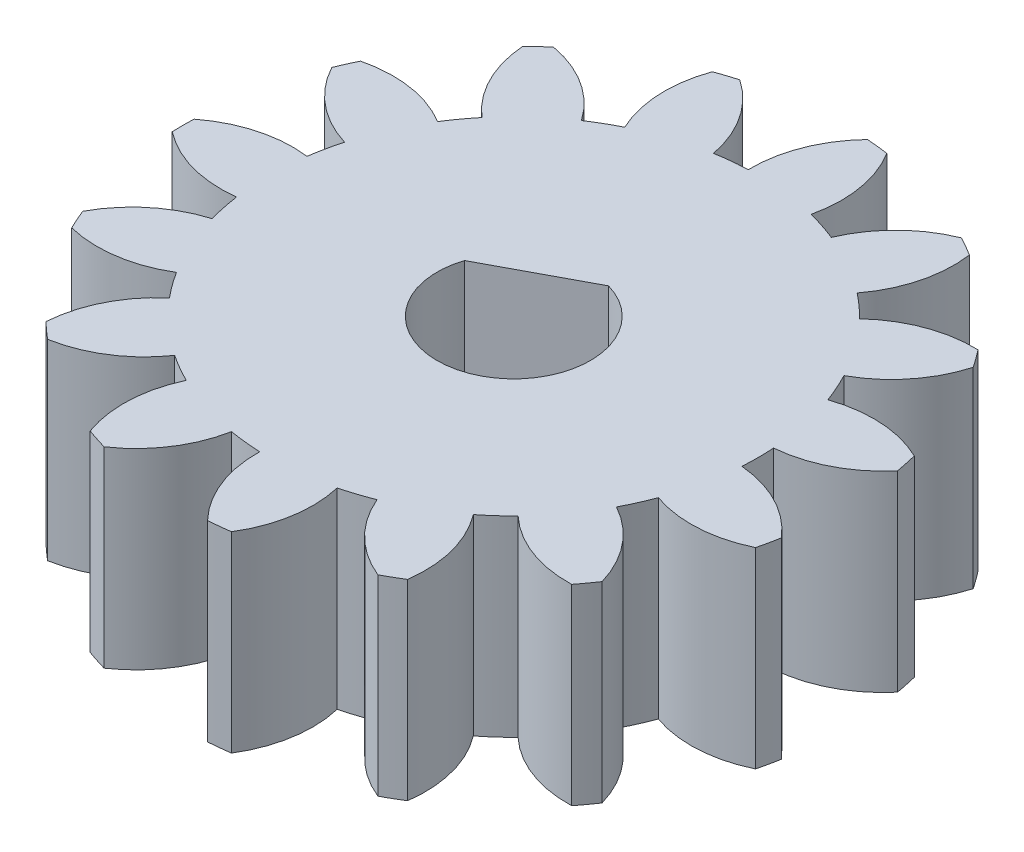
from build123d import *

# Parameters (mm, degrees)
SKETCH1_R           = 56.531668112
BOSS_EXTRUDE1_DEPTH = 5
SKETCH2_R           = 93.360470672
CUT_EXTRUDE1_DEPTH  = 83.481553238
CUT_EXTRUDE2_DEPTH  = 14.170680132


with BuildPart() as part:
    # Sketch1 → Boss-Extrude1 (new body)
    with BuildSketch(Plane(origin=(0, 0, 0), x_dir=(1, 0, 0), z_dir=(0, 1, 0))):
        Circle(SKETCH1_R)
    extrude(amount=BOSS_EXTRUDE1_DEPTH)

    # Sketch2 → Cut-Extrude1 (cut, through all)
    with BuildSketch(Plane(origin=(0.053951493, 9.696123263, -2.690451675), x_dir=(0, 0, 1), z_dir=(0, 1, 0))):
        with Locations((2.690451675, -0.053951493)):
            Circle(SKETCH2_R)
        with BuildLine():
            ThreePointArc((7.987976033, 6.754966533), (7.789005891, 5.548363877), (7.142485611, 4.510341424))
            ThreePointArc((7.142485611, 4.510341424), (7.428743082, 4.212425253), (7.695105184, 3.89659521))
            ThreePointArc((7.695105184, 3.89659521), (8.795021012, 4.431070894), (10.015811815, 4.502826734))
            ThreePointArc((10.015811815, 4.502826734), (10.161652833, 4.259548507), (10.299417449, 4.011607367))
            ThreePointArc((10.299417449, 4.011607367), (9.626879667, 2.990249439), (8.614052233, 2.304932231))
            ThreePointArc((8.614052233, 2.304932231), (8.754388023, 1.916340863), (8.869262259, 1.519476535))
            ThreePointArc((8.869262259, 1.519476535), (10.091476214, 1.560368296), (11.235909836, 1.129380165))
            ThreePointArc((11.235909836, 1.129380165), (11.270192066, 0.84781556), (11.295199558, 0.56527614))
            ThreePointArc((11.295199558, 0.56527614), (10.265382027, -0.094234996), (9.061374505, -0.308349388))
            ThreePointArc((9.061374505, -0.308349388), (9.03152328, -0.720424975), (8.975046852, -1.12970214))
            ThreePointArc((8.975046852, -1.12970214), (10.108227036, -1.589464859), (10.978420508, -2.448675198))
            ThreePointArc((10.978420508, -2.448675198), (10.895216241, -2.719841104), (10.803142587, -2.98812517))
            ThreePointArc((10.803142587, -2.98812517), (9.594110113, -3.171754047), (8.407106342, -2.8776433))
            ThreePointArc((8.407106342, -2.8776433), (8.212229649, -3.241951493), (7.994167845, -3.592873756))
            ThreePointArc((7.994167845, -3.592873756), (8.84237711, -4.473793803), (9.287866075, -5.612661077))
            ThreePointArc((9.287866075, -5.612661077), (9.101562084, -5.826541234), (8.908327655, -6.034181196))
            ThreePointArc((8.908327655, -6.034181196), (7.729132938, -5.710176712), (6.764376652, -4.958695246))
            ThreePointArc((6.764376652, -4.958695246), (6.438170443, -5.212243849), (6.09622813, -5.444133562))
            ThreePointArc((6.09622813, -5.444133562), (6.512803388, -6.593891859), (6.456558756, -7.81549557))
            ThreePointArc((6.456558756, -7.81549557), (6.199368695, -7.935108156), (5.938385479, -8.046201177))
            ThreePointArc((5.938385479, -8.046201177), (4.992921997, -7.270586652), (4.417228324, -6.191672439))
            ThreePointArc((4.417228324, -6.191672439), (4.016096616, -6.290620595), (3.609398725, -6.363381921))
            ThreePointArc((3.609398725, -6.363381921), (3.52231033, -7.583174812), (2.974057309, -8.67628858))
            ThreePointArc((2.974057309, -8.67628858), (2.690451675, -8.680951493), (2.406846041, -8.67628858))
            ThreePointArc((2.406846041, -8.67628858), (1.85859302, -7.583174812), (1.771504625, -6.363381921))
            ThreePointArc((1.771504625, -6.363381921), (1.364806734, -6.290620595), (0.963675026, -6.191672439))
            ThreePointArc((0.963675026, -6.191672439), (0.387981353, -7.270586652), (-0.557482129, -8.046201177))
            ThreePointArc((-0.557482129, -8.046201177), (-0.818465345, -7.935108156), (-1.075655406, -7.81549557))
            ThreePointArc((-1.075655406, -7.81549557), (-1.131900038, -6.593891859), (-0.71532478, -5.444133562))
            ThreePointArc((-0.71532478, -5.444133562), (-1.057267094, -5.212243849), (-1.383473303, -4.958695246))
            ThreePointArc((-1.383473303, -4.958695246), (-2.348229588, -5.710176712), (-3.527424305, -6.034181196))
            ThreePointArc((-3.527424305, -6.034181196), (-3.720658735, -5.826541234), (-3.906962725, -5.612661077))
            ThreePointArc((-3.906962725, -5.612661077), (-3.46147376, -4.473793803), (-2.613264496, -3.592873756))
            ThreePointArc((-2.613264496, -3.592873756), (-2.8313263, -3.241951493), (-3.026202992, -2.8776433))
            ThreePointArc((-3.026202992, -2.8776433), (-4.213206764, -3.171754047), (-5.422239237, -2.98812517))
            ThreePointArc((-5.422239237, -2.98812517), (-5.514312891, -2.719841104), (-5.597517158, -2.448675198))
            ThreePointArc((-5.597517158, -2.448675198), (-4.727323686, -1.589464859), (-3.594143503, -1.12970214))
            ThreePointArc((-3.594143503, -1.12970214), (-3.65061993, -0.720424975), (-3.680471156, -0.308349388))
            ThreePointArc((-3.680471156, -0.308349388), (-4.884478677, -0.094234996), (-5.914296209, 0.56527614))
            ThreePointArc((-5.914296209, 0.56527614), (-5.889288716, 0.84781556), (-5.855006486, 1.129380165))
            ThreePointArc((-5.855006486, 1.129380165), (-4.710572864, 1.560368296), (-3.48835891, 1.519476535))
            ThreePointArc((-3.48835891, 1.519476535), (-3.373484673, 1.916340863), (-3.233148884, 2.304932231))
            ThreePointArc((-3.233148884, 2.304932231), (-4.245976317, 2.990249439), (-4.9185141, 4.011607367))
            ThreePointArc((-4.9185141, 4.011607367), (-4.780749484, 4.259548507), (-4.634908466, 4.502826734))
            ThreePointArc((-4.634908466, 4.502826734), (-3.414117662, 4.431070894), (-2.314201834, 3.89659521))
            ThreePointArc((-2.314201834, 3.89659521), (-2.047839732, 4.212425253), (-1.761582261, 4.510341424))
            ThreePointArc((-1.761582261, 4.510341424), (-2.408102542, 5.548363877), (-2.607072683, 6.754966533))
            ThreePointArc((-2.607072683, 6.754966533), (-2.380371697, 6.925438117), (-2.148189128, 7.088364951))
            ThreePointArc((-2.148189128, 7.088364951), (-1.062126964, 6.526272375), (-0.274694701, 5.590628471))
            ThreePointArc((-0.274694701, 5.590628471), (0.097098839, 5.770814345), (0.479781475, 5.926542907))
            ThreePointArc((0.479781475, 5.926542907), (0.311357577, 7.137787092), (0.620358822, 8.321001915))
            ThreePointArc((0.620358822, 8.321001915), (0.896797518, 8.384527858), (1.175175163, 8.438931768))
            ThreePointArc((1.175175163, 8.438931768), (1.938718671, 7.483693371), (2.277513178, 6.308662576))
            ThreePointArc((2.277513178, 6.308662576), (2.690451675, 6.322048507), (3.103390171, 6.308662576))
            ThreePointArc((3.103390171, 6.308662576), (3.442184678, 7.483693371), (4.205728187, 8.438931768))
            ThreePointArc((4.205728187, 8.438931768), (4.484105832, 8.384527858), (4.760544528, 8.321001915))
            ThreePointArc((4.760544528, 8.321001915), (5.069545773, 7.137787092), (4.901121875, 5.926542907))
            ThreePointArc((4.901121875, 5.926542907), (5.283804511, 5.770814345), (5.65559805, 5.590628471))
            ThreePointArc((5.65559805, 5.590628471), (6.443030314, 6.526272375), (7.529092477, 7.088364951))
            ThreePointArc((7.529092477, 7.088364951), (7.761275046, 6.925438117), (7.987976033, 6.754966533))
        make_face(mode=Mode.SUBTRACT)
    extrude(amount=-CUT_EXTRUDE1_DEPTH, mode=Mode.SUBTRACT)

    # Sketch3 → Cut-Extrude2 (cut, through all)
    with BuildSketch(Plane(origin=(0, 5, 0), x_dir=(1, 0, 0), z_dir=(0, 1, 0))):
        with BuildLine():
            Line((-1.902202661, 0.617758073), (0.547338577, 1.923647702))
            ThreePointArc((0.547338577, 1.923647702), (0.940877836, -1.764865122), (-1.902202661, 0.617758073))
        make_face()
    extrude(amount=-CUT_EXTRUDE2_DEPTH, mode=Mode.SUBTRACT)


solid = part.part
